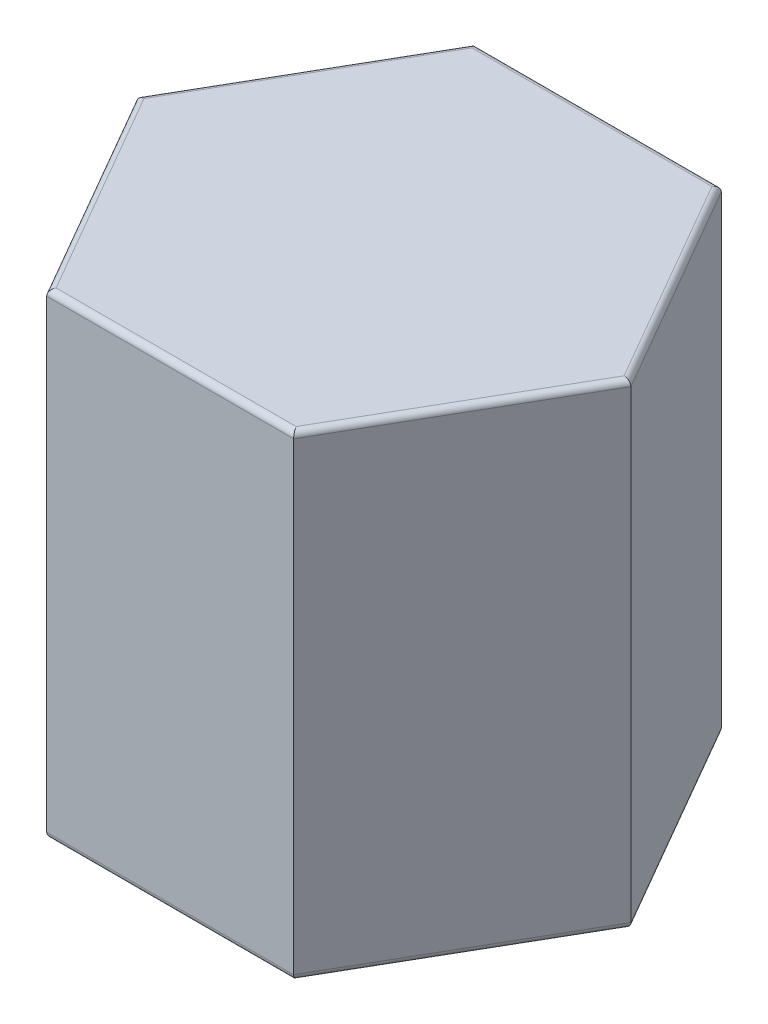
from build123d import *

# Parameters (mm, degrees)
BOSS_EXTRUDE1_DEPTH = 40
FILLET1_R           = 0.5


with BuildPart() as part:
    # Sketch1 → Boss-Extrude1 (new body)
    with BuildSketch(Plane(origin=(0, 0, 0), x_dir=(1, 0, 0), z_dir=(0, 1, 0))):
        Polygon((-10.375, 17.970027129), (-20.75, 0), (-10.375, -17.970027129), (10.375, -17.970027129), (20.75, 0), (10.375, 17.970027129), align=None)
    extrude(amount=BOSS_EXTRUDE1_DEPTH)

    # Fillet1
    fillet1_edges = [part.edges().sort_by_distance(p)[0] for p in [
        (-15.5625, 0, -8.985013564),
        (-15.5625, 0, 8.985013564),
        (0, 0, 17.970027129),
        (15.5625, 0, 8.985013564),
        (15.5625, 0, -8.985013564),
        (0, 0, -17.970027129),
        (15.5625, 40, -8.985013564),
        (15.5625, 40, 8.985013564),
        (0, 40, 17.970027129),
        (-15.5625, 40, 8.985013564),
        (-15.5625, 40, -8.985013564),
        (0, 40, -17.970027129),
    ]]
    fillet(fillet1_edges, radius=FILLET1_R)


solid = part.part
